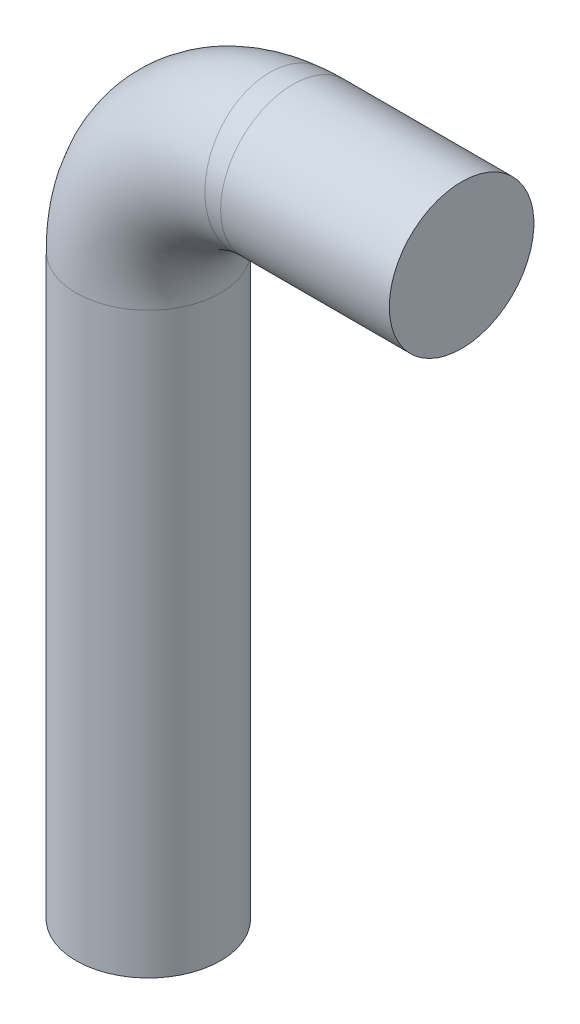
from build123d import *

# Parameters (mm, degrees)
SKETCH2_R = 1.5


with BuildPart() as part:
    # Sweep1: sweep along a path in Sketch1
    with BuildLine() as sweep1_path:  # in the path sketch's own coordinates; laid on its plane below (add() does not lay a ready-made edge on the line's plane)
        Line((0, 0), (0, 12))
        add(Edge.make_bspline(
            [(0, 12), (0, 12.023413968), (0.000699371, 12.070252186), (0.003846497, 12.181723934), (0.012233377, 12.272232908), (0.024798266, 12.396442372), (0.041525399, 12.499812732), (0.062388273, 12.614640544), (0.087362903, 12.721343062), (0.116405833, 12.831310993), (0.149490037, 12.937716462), (0.195814076, 13.070562925), (0.259297024, 13.226265379), (0.34454565, 13.403506134), (0.456885346, 13.597920912), (0.583359153, 13.783560299), (0.723484367, 13.95913143), (0.876121004, 14.123802582), (1.040993812, 14.276562511), (1.216234103, 14.416611655), (1.402416339, 14.543133558), (1.595943115, 14.655440873), (1.799940691, 14.752893226), (2.006321819, 14.834953135), (2.225479443, 14.901157071), (2.436590149, 14.951137686), (2.644113547, 14.98042908), (2.790931007, 14.995104413), (2.930324511, 14.999300626), (2.976586032, 15), (3, 15)],
            knots=[0.082637729, 0.082637729, 0.082637729, 0.082637729, 0.082637729, 0.102512123, 0.122386517, 0.142260911, 0.162135305, 0.182009699, 0.201884092, 0.221758486, 0.24163288, 0.261507274, 0.281381668, 0.321130455, 0.360879243, 0.400628031, 0.440376818, 0.480125606, 0.519874394, 0.559623182, 0.599371969, 0.639120757, 0.678869545, 0.718618332, 0.75836712, 0.798115908, 0.837864695, 0.877613483, 0.897487877, 0.917362271, 0.917362271, 0.917362271, 0.917362271, 0.917362271], degree=4))
        Line((3, 15), (6.5, 15))
    # Sketch2 → Sweep1 (sweep)
    with BuildSketch(Plane(origin=(0, 0, 0), x_dir=(1, 0, 0), z_dir=(0, 1, 0))):
        Circle(SKETCH2_R)
    sweep(path=Plane.XY * sweep1_path.line)


solid = part.part
